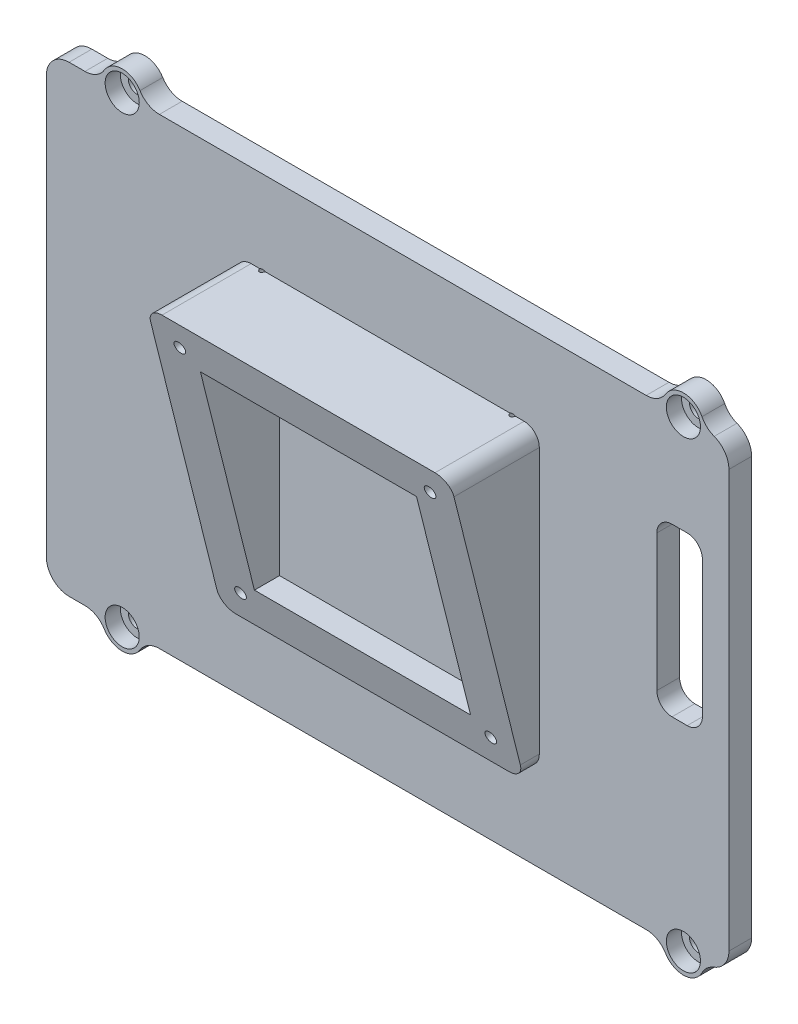
from build123d import *

# Parameters (mm, degrees)
SKETCH_29_W                          = 90
SKETCH_29_H                          = 61
EXTRUDE_5047_DEPTH                   = 1.5
CUT_EXTRUDE_5288_REACH               = 56.445
SKETCH_30_W                          = 6
SKETCH_30_H                          = 22
FILLET_3_R                           = 3
EXTRUDE_6672_DEPTH                   = 3
CUT_EXTRUDE_7204_REACH               = 58.032
SKETCH_34_R                          = 1.2
SKETCH_35_R                          = 2.25
CUT_EXTRUDE_7829_DEPTH               = 2
FILLET_5_R                           = 2
SKETCH_36_W                          = 40
SKETCH_36_H                          = 39
SKETCH_36_W_2                        = 28.5
SKETCH_36_H_2                        = 28.5
EXTRUDE_8958_DEPTH                   = 12
CHAMFER_2_SIZE                       = 10
CHAMFER_2_SIZE_2                     = 40
CUT_EXTRUDE_9379_REACH               = 60.91
CUT_EXTRUDE_9379_OFFSET_FROM_SURFACE = 1
SKETCH_37_R                          = 0.75
CUT_EXTRUDE_9641_REACH               = 59.172
SKETCH_38_W                          = 15
SKETCH_38_H                          = 8
FILLET_6_R                           = 2
FILLET_7_R                           = 2
FILLET_8_R                           = 3


with BuildPart() as part:
    # Эскиз29 → Extrude 5047 (new, symmetric)
    with BuildSketch(Plane.XY):
        Rectangle(SKETCH_29_W, SKETCH_29_H)
    extrude(amount=EXTRUDE_5047_DEPTH, both=True)

    # Эскиз30 → Cut-Extrude 5288 (cut, up to next)
    with BuildSketch(Plane.XY.offset(1.5), mode=Mode.PRIVATE) as cut_extrude_5288_sk1:
        with Locations((38.5, 6.5)):
            Rectangle(SKETCH_30_W, SKETCH_30_H)
    cut_extrude_5288_tool1 = extrude(cut_extrude_5288_sk1.sketch, amount=-CUT_EXTRUDE_5288_REACH, mode=Mode.PRIVATE) & part.part
    add(cut_extrude_5288_tool1.solids().sort_by_distance((38.5, 6.5, 1.5))[0], mode=Mode.SUBTRACT)

    # Скругление3
    fillet_3_edges = [part.edges().sort_by_distance(p)[0] for p in [
        (-45, 30.5, 0),
        (45, 30.5, 0),
        (45, -30.5, 0),
        (-45, -30.5, 0),
    ]]
    fillet(fillet_3_edges, radius=FILLET_3_R)

    # Эскиз33 → Extrude 6672 (add)
    with BuildSketch(Plane.XY.offset(1.5)):
        with BuildLine():
            Line((-37.75, -30.5), (-32.25, -30.5))
            ThreePointArc((-32.25, -30.5), (-35, -33.25), (-37.75, -30.5))
        make_face()
        with BuildLine():
            Line((-37.75, 30.5), (-32.25, 30.5))
            ThreePointArc((-32.25, 30.5), (-35, 33.25), (-37.75, 30.5))
        make_face()
        with BuildLine():
            Line((41.75, -30.5), (36.25, -30.5))
            ThreePointArc((36.25, -30.5), (39, -33.25), (41.75, -30.5))
        make_face()
        with BuildLine():
            Line((36.25, 30.5), (41.75, 30.5))
            ThreePointArc((41.75, 30.5), (39, 33.25), (36.25, 30.5))
        make_face()
    extrude(amount=-EXTRUDE_6672_DEPTH)

    # Эскиз34 → Cut-Extrude 7204 (cut, up to next)
    with BuildSketch(Plane.XY.offset(1.5), mode=Mode.PRIVATE) as cut_extrude_7204_sk1:
        with Locations((-35, -30.5)):
            Circle(SKETCH_34_R)
    cut_extrude_7204_tool1 = extrude(cut_extrude_7204_sk1.sketch, amount=-CUT_EXTRUDE_7204_REACH, mode=Mode.PRIVATE) & part.part
    # Эскиз34 → Cut-Extrude 7204 (cut, up to next)
    with BuildSketch(Plane.XY.offset(1.5), mode=Mode.PRIVATE) as cut_extrude_7204_sk2:
        with Locations((39, -30.5)):
            Circle(SKETCH_34_R)
    cut_extrude_7204_tool2 = extrude(cut_extrude_7204_sk2.sketch, amount=-CUT_EXTRUDE_7204_REACH, mode=Mode.PRIVATE) & part.part
    # Эскиз34 → Cut-Extrude 7204 (cut, up to next)
    with BuildSketch(Plane.XY.offset(1.5), mode=Mode.PRIVATE) as cut_extrude_7204_sk3:
        with Locations((-35, 30.5)):
            Circle(SKETCH_34_R)
    cut_extrude_7204_tool3 = extrude(cut_extrude_7204_sk3.sketch, amount=-CUT_EXTRUDE_7204_REACH, mode=Mode.PRIVATE) & part.part
    # Эскиз34 → Cut-Extrude 7204 (cut, up to next)
    with BuildSketch(Plane.XY.offset(1.5), mode=Mode.PRIVATE) as cut_extrude_7204_sk4:
        with Locations((39, 30.5)):
            Circle(SKETCH_34_R)
    cut_extrude_7204_tool4 = extrude(cut_extrude_7204_sk4.sketch, amount=-CUT_EXTRUDE_7204_REACH, mode=Mode.PRIVATE) & part.part
    add(cut_extrude_7204_tool1.solids().sort_by_distance((-35, -30.5, 1.5))[0], mode=Mode.SUBTRACT)
    add(cut_extrude_7204_tool2.solids().sort_by_distance((39, -30.5, 1.5))[0], mode=Mode.SUBTRACT)
    add(cut_extrude_7204_tool3.solids().sort_by_distance((-35, 30.5, 1.5))[0], mode=Mode.SUBTRACT)
    add(cut_extrude_7204_tool4.solids().sort_by_distance((39, 30.5, 1.5))[0], mode=Mode.SUBTRACT)

    # Эскиз35 → Cut-Extrude 7829 (cut)
    with BuildSketch(Plane.XY.offset(1.5)):
        with Locations((-35, -30.5)):
            Circle(SKETCH_35_R)
        with Locations((-35, 30.5)):
            Circle(SKETCH_35_R)
        with Locations((39, -30.5)):
            Circle(SKETCH_35_R)
        with Locations((39, 30.5)):
            Circle(SKETCH_35_R)
    extrude(amount=-CUT_EXTRUDE_7829_DEPTH, mode=Mode.SUBTRACT)

    # Скругление5
    fillet_5_edges = [part.edges().sort_by_distance(p)[0] for p in [
        (35.5, -4.5, 0),
        (35.5, 17.5, 0),
        (41.5, 17.5, 0),
        (41.5, -4.5, 0),
    ]]
    fillet(fillet_5_edges, radius=FILLET_5_R)

    # Эскиз36 → Extrude 8958 (add)
    with BuildSketch(Plane.XY.offset(1.5)):
        Rectangle(SKETCH_36_W, SKETCH_36_H)
        Rectangle(SKETCH_36_W_2, SKETCH_36_H_2, mode=Mode.SUBTRACT)
    extrude(amount=EXTRUDE_8958_DEPTH)

    # Фаска2
    # the kernel refuses this chamfer: 40, 10 mm, written as the material it takes off along each edge
    with BuildSketch(Plane(origin=(123.885099991, -19.5, 13.5), x_dir=(0, -0.14778356633657133, -0.9890197255468893), z_dir=(-1, 0, 0))) as chamfer_2_piece_1:
        Polygon((CHAMFER_2_SIZE * 0.989019725547, -CHAMFER_2_SIZE * 0.147783566337), (-CHAMFER_2_SIZE_2 * 0.147783566337, -CHAMFER_2_SIZE_2 * 0.989019725547), (0, 0), align=None)
    extrude(amount=247.770199982, mode=Mode.SUBTRACT)

    # Cut-Extrude 9379: up to this face of the body (flat: up to its plane, moved by the offset)
    cut_extrude_9379_end = Plane(part.part.faces().sort_by_distance((-0.908572553, -0.15524083, -1.5))[0]).offset(-CUT_EXTRUDE_9379_OFFSET_FROM_SURFACE)
    # Эскиз37 → Cut-Extrude 9379 (cut, up to the picked face)
    with BuildSketch(Plane(origin=(0, -1.970588235, 7.882352941), x_dir=(1, 0, 0), z_dir=(0, -0.24253562503633005, 0.9701425001453328)), mode=Mode.PRIVATE) as cut_extrude_9379_sk1:
        with Locations(Location((-16.5, 18.631375785, 0), (0, 0, 270))):
            Circle(SKETCH_37_R)
    cut_extrude_9379_tool1 = split(extrude(cut_extrude_9379_sk1.sketch, amount=-CUT_EXTRUDE_9379_REACH, mode=Mode.PRIVATE), bisect_by=cut_extrude_9379_end, keep=Keep.BOTH, mode=Mode.PRIVATE)
    # Эскиз37 → Cut-Extrude 9379 (cut, up to the picked face)
    with BuildSketch(Plane(origin=(0, -1.970588235, 7.882352941), x_dir=(1, 0, 0), z_dir=(0, -0.24253562503633005, 0.9701425001453328)), mode=Mode.PRIVATE) as cut_extrude_9379_sk2:
        with Locations(Location((16.5, 18.631375785, 0), (0, 0, 270))):
            Circle(SKETCH_37_R)
    cut_extrude_9379_tool2 = split(extrude(cut_extrude_9379_sk2.sketch, amount=-CUT_EXTRUDE_9379_REACH, mode=Mode.PRIVATE), bisect_by=cut_extrude_9379_end, keep=Keep.BOTH, mode=Mode.PRIVATE)
    # Эскиз37 → Cut-Extrude 9379 (cut, up to the picked face)
    with BuildSketch(Plane(origin=(0, -1.970588235, 7.882352941), x_dir=(1, 0, 0), z_dir=(0, -0.24253562503633005, 0.9701425001453328)), mode=Mode.PRIVATE) as cut_extrude_9379_sk3:
        with Locations(Location((16.5, -14.368624215, 0), (0, 0, 270))):
            Circle(SKETCH_37_R)
    cut_extrude_9379_tool3 = split(extrude(cut_extrude_9379_sk3.sketch, amount=-CUT_EXTRUDE_9379_REACH, mode=Mode.PRIVATE), bisect_by=cut_extrude_9379_end, keep=Keep.BOTH, mode=Mode.PRIVATE)
    # Эскиз37 → Cut-Extrude 9379 (cut, up to the picked face)
    with BuildSketch(Plane(origin=(0, -1.970588235, 7.882352941), x_dir=(1, 0, 0), z_dir=(0, -0.24253562503633005, 0.9701425001453328)), mode=Mode.PRIVATE) as cut_extrude_9379_sk4:
        with Locations(Location((-16.5, -14.368624215, 0), (0, 0, 270))):
            Circle(SKETCH_37_R)
    cut_extrude_9379_tool4 = split(extrude(cut_extrude_9379_sk4.sketch, amount=-CUT_EXTRUDE_9379_REACH, mode=Mode.PRIVATE), bisect_by=cut_extrude_9379_end, keep=Keep.BOTH, mode=Mode.PRIVATE)
    add(cut_extrude_9379_tool1.solids().sort_by(Axis((-16.5, 16.104501, 12.401125), (0, 0.24253562503633005, -0.9701425001453328)))[0], mode=Mode.SUBTRACT)
    add(cut_extrude_9379_tool2.solids().sort_by(Axis((16.5, 16.104501, 12.401125), (0, 0.24253562503633005, -0.9701425001453328)))[0], mode=Mode.SUBTRACT)
    add(cut_extrude_9379_tool3.solids().sort_by(Axis((16.5, -15.910201, 4.39745), (0, 0.24253562503633005, -0.9701425001453328)))[0], mode=Mode.SUBTRACT)
    add(cut_extrude_9379_tool4.solids().sort_by(Axis((-16.5, -15.910201, 4.39745), (0, 0.24253562503633005, -0.9701425001453328)))[0], mode=Mode.SUBTRACT)

    # Эскиз38 → Cut-Extrude 9641 (cut, up to next)
    with BuildSketch(Plane.XY.offset(1.5), mode=Mode.PRIVATE) as cut_extrude_9641_sk1:
        with Locations((0, 10.25)):
            Rectangle(SKETCH_38_W, SKETCH_38_H)
    cut_extrude_9641_tool1 = extrude(cut_extrude_9641_sk1.sketch, amount=-CUT_EXTRUDE_9641_REACH, mode=Mode.PRIVATE) & part.part
    add(cut_extrude_9641_tool1.solids().sort_by_distance((0, 10.25, 1.5))[0], mode=Mode.SUBTRACT)

    # Скругление6
    fillet_6_edges = [part.edges().sort_by_distance(p)[0] for p in [
        (-7.5, 6.25, 0),
        (-7.5, 14.25, 0),
        (7.5, 14.25, 0),
        (7.5, 6.25, 0),
    ]]
    fillet(fillet_6_edges, radius=FILLET_6_R)

    # Скругление7
    fillet_7_edges = [part.edges().sort_by_distance(p)[0] for p in [
        (-20, 19.5, 7.375),
        (20, 19.5, 7.375),
        (20, -19.5, 2.5),
        (-20, -19.5, 2.5),
    ]]
    fillet(fillet_7_edges, radius=FILLET_7_R)

    # Скругление8
    fillet_8_edges = [part.edges().sort_by_distance(p)[0] for p in [
        (-37.75, 30.5, 0),
        (-32.25, 30.5, 0),
        (41.75, -30.5, 0),
        (36.25, -30.5, 0),
        (-32.25, -30.5, 0),
        (-37.75, -30.5, 0),
        (36.25, 30.5, 0),
        (41.75, 30.5, 0),
    ]]
    fillet(fillet_8_edges, radius=FILLET_8_R)


solid = part.part
